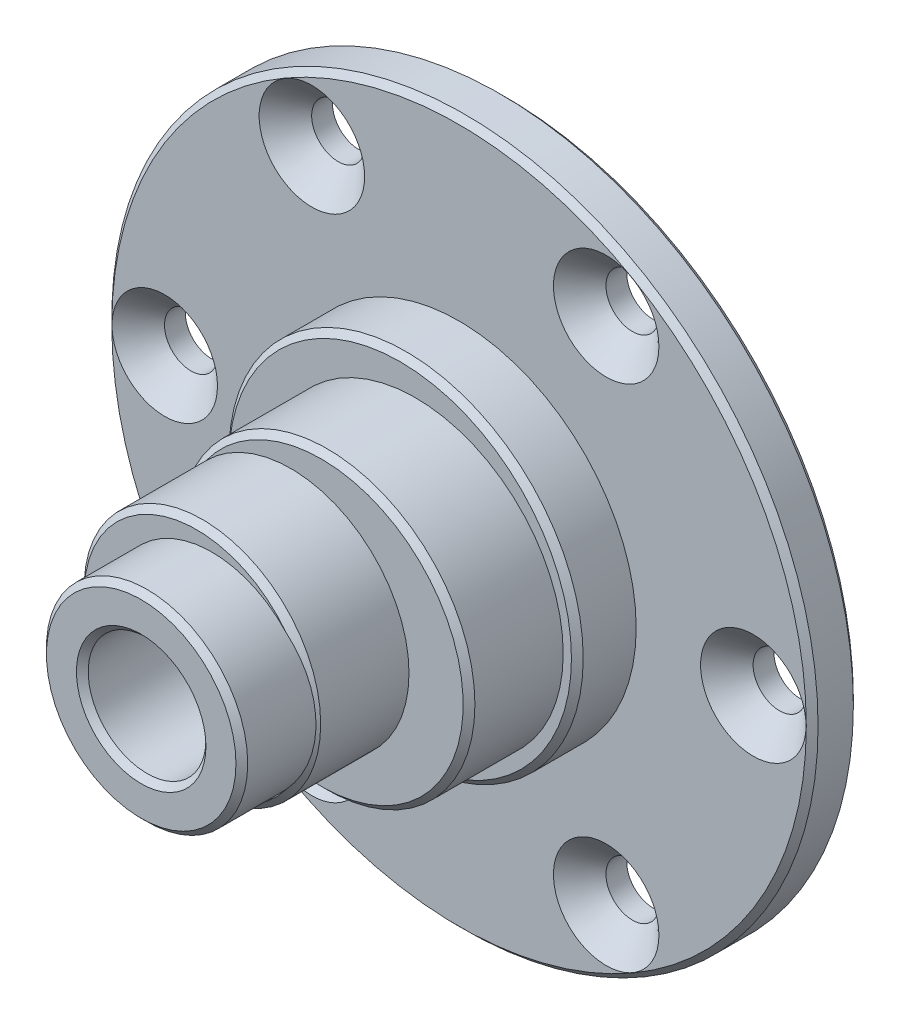
from build123d import *

# Parameters (mm, degrees)
SKETCH1_R                                    = 30
BOSS_EXTRUDE1_DEPTH                          = 4
CSK_FOR_M4_HEX_SOCKET_COUNTERSUNK_CA_2_COUNT = 2
CSK_FOR_M4_HEX_SOCKET_COUNTERSUNK_CA_2_PITCH = 25
CSK_FOR_M4_HEX_SOCKET_COUNTERSUNK_CA_3_COUNT = 2
CSK_FOR_M4_HEX_SOCKET_COUNTERSUNK_CA_3_PITCH = 43.301270189
CSK_FOR_M4_HEX_SOCKET_COUNTERSUNK_CA_4_COUNT = 2
CSK_FOR_M4_HEX_SOCKET_COUNTERSUNK_CA_4_PITCH = 43.301270189
CSK_FOR_M4_HEX_SOCKET_COUNTERSUNK_CA_5_COUNT = 2
CSK_FOR_M4_HEX_SOCKET_COUNTERSUNK_CA_5_PITCH = 50
CSK_FOR_M4_HEX_SOCKET_COUNTERSUNK_CA_6_COUNT = 2
CSK_FOR_M4_HEX_SOCKET_COUNTERSUNK_CA_6_PITCH = 25
SKETCH2_R                                    = 15.05
SKETCH2_R_2                                  = 10.05
BOSS_EXTRUDE3_DEPTH                          = 5
SKETCH5_R                                    = 12
CUT_EXTRUDE2_DEPTH                           = 4
SKETCH6_R                                    = 12.55
BOSS_EXTRUDE4_DEPTH                          = 8
SKETCH7_R                                    = 10.05
BOSS_EXTRUDE5_DEPTH                          = 8
SKETCH8_R                                    = 8.55
BOSS_EXTRUDE6_DEPTH                          = 6
SKETCH9_R                                    = 5
CUT_EXTRUDE3_DEPTH                           = 30
CHAMFER1_SIZE                                = 0.5


with BuildPart() as part:
    # Sketch1 → Boss-Extrude1 (new body)
    with BuildSketch(Plane.XY):
        Circle(SKETCH1_R)
    extrude(amount=BOSS_EXTRUDE1_DEPTH)

    # Sketch3 → CSK for M4 Hex Socket Countersunk Cap Screw1 (revolve, cut)
    with BuildSketch(Plane(origin=(-12.5, 21.650635095, 4), x_dir=(0, -1, 0), z_dir=(1, 0, 0))):
        Polygon((0, 0), (0, 4), (2.25, 4), (2.25, 2.23), (4.48, 0), align=None)
    csk_for_m4_hex_socket_countersunk_cap_sc = revolve(axis=Axis((-12.5, 21.650635095, 10.35), (0, 0, -1)), mode=Mode.SUBTRACT)

    # CSK for M4 Hex Socket Countersunk Ca 2: CSK for M4 Hex Socket Countersunk Cap Screw1 ×2
    with Locations(*[(i * CSK_FOR_M4_HEX_SOCKET_COUNTERSUNK_CA_2_PITCH, 0, 0) for i in range(1, CSK_FOR_M4_HEX_SOCKET_COUNTERSUNK_CA_2_COUNT)]):
        add(csk_for_m4_hex_socket_countersunk_cap_sc, mode=Mode.SUBTRACT)

    # CSK for M4 Hex Socket Countersunk Ca 3: CSK for M4 Hex Socket Countersunk Cap Screw1 ×2
    with Locations(*[Vector(0.8660254037844606, -0.4999999999999621, 0) * (i * CSK_FOR_M4_HEX_SOCKET_COUNTERSUNK_CA_3_PITCH) for i in range(1, CSK_FOR_M4_HEX_SOCKET_COUNTERSUNK_CA_3_COUNT)]):
        add(csk_for_m4_hex_socket_countersunk_cap_sc, mode=Mode.SUBTRACT)

    # CSK for M4 Hex Socket Countersunk Ca 4: CSK for M4 Hex Socket Countersunk Cap Screw1 ×2
    with Locations(*[(0, -i * CSK_FOR_M4_HEX_SOCKET_COUNTERSUNK_CA_4_PITCH, 0) for i in range(1, CSK_FOR_M4_HEX_SOCKET_COUNTERSUNK_CA_4_COUNT)]):
        add(csk_for_m4_hex_socket_countersunk_cap_sc, mode=Mode.SUBTRACT)

    # CSK for M4 Hex Socket Countersunk Ca 5: CSK for M4 Hex Socket Countersunk Cap Screw1 ×2
    with Locations(*[Vector(0.5000000000000379, -0.8660254037844168, 0) * (i * CSK_FOR_M4_HEX_SOCKET_COUNTERSUNK_CA_5_PITCH) for i in range(1, CSK_FOR_M4_HEX_SOCKET_COUNTERSUNK_CA_5_COUNT)]):
        add(csk_for_m4_hex_socket_countersunk_cap_sc, mode=Mode.SUBTRACT)

    # CSK for M4 Hex Socket Countersunk Ca 6: CSK for M4 Hex Socket Countersunk Cap Screw1 ×2
    with Locations(*[Vector(-0.49999999999996236, -0.8660254037844605, 0) * (i * CSK_FOR_M4_HEX_SOCKET_COUNTERSUNK_CA_6_PITCH) for i in range(1, CSK_FOR_M4_HEX_SOCKET_COUNTERSUNK_CA_6_COUNT)]):
        add(csk_for_m4_hex_socket_countersunk_cap_sc, mode=Mode.SUBTRACT)

    # Sketch2 → Boss-Extrude3 (add)
    with BuildSketch(Plane.XY.offset(4)):
        Circle(SKETCH2_R)
        Circle(SKETCH2_R_2, mode=Mode.SUBTRACT)
    extrude(amount=BOSS_EXTRUDE3_DEPTH)

    # Sketch5 → Cut-Extrude2 (cut)
    with BuildSketch(Plane(origin=(0, 0, 0), x_dir=(-1, 0, 0), z_dir=(0, 0, -1))):
        Circle(SKETCH5_R)
    extrude(amount=-CUT_EXTRUDE2_DEPTH, mode=Mode.SUBTRACT)

    # Sketch6 → Boss-Extrude4 (add)
    with BuildSketch(Plane.XY.offset(9)):
        with Locations((1.3, 0)):
            Circle(SKETCH6_R)
    extrude(amount=BOSS_EXTRUDE4_DEPTH)

    # Sketch7 → Boss-Extrude5 (add)
    with BuildSketch(Plane.XY.offset(17)):
        with Locations(Location((-1.3, 0, 0), (0, 0, 162.13454876))):
            Circle(SKETCH7_R)
    extrude(amount=BOSS_EXTRUDE5_DEPTH)

    # Sketch8 → Boss-Extrude6 (add)
    with BuildSketch(Plane.XY.offset(25)):
        Circle(SKETCH8_R)
    extrude(amount=BOSS_EXTRUDE6_DEPTH)

    # Sketch9 → Cut-Extrude3 (cut)
    with BuildSketch(Plane.XY.offset(31)):
        Circle(SKETCH9_R)
    extrude(amount=-CUT_EXTRUDE3_DEPTH, mode=Mode.SUBTRACT)

    # Chamfer1
    # the kernel refuses this chamfer: 0.5 mm, written as the material it takes off along each edge
    with BuildSketch(Plane(origin=(0, 0, 0), x_dir=(1, 0, 0), z_dir=(0, -1, 0))) as chamfer1_piece_1:
        Polygon((30, CHAMFER1_SIZE), (30 - CHAMFER1_SIZE, 0), (30, 0), align=None)
    revolve(axis=Axis((0, 0, 0), (0, 0, 1)), mode=Mode.SUBTRACT)
    with BuildSketch(Plane(origin=(0, 0, 9), x_dir=(1, 0, 0), z_dir=(0, -1, 0))) as chamfer1_piece_2:
        Polygon((15.05, -CHAMFER1_SIZE), (15.05 - CHAMFER1_SIZE, 0), (15.05, 0), align=None)
    revolve(axis=Axis((0, 0, 9), (0, 0, 1)), mode=Mode.SUBTRACT)
    with BuildSketch(Plane(origin=(0, 0, 4), x_dir=(1, 0, 0), z_dir=(0, -1, 0))) as chamfer1_piece_3:
        Polygon((30, -CHAMFER1_SIZE), (30 - CHAMFER1_SIZE, 0), (30, 0), align=None)
    revolve(axis=Axis((0, 0, 4), (0, 0, 1)), mode=Mode.SUBTRACT)
    with BuildSketch(Plane(origin=(0, 0, 4), x_dir=(1, 0, 0), z_dir=(0, -1, 0))) as chamfer1_piece_4:
        Polygon((10.05 + CHAMFER1_SIZE, 0), (10.05, CHAMFER1_SIZE), (10.05, 0), align=None)
    revolve(axis=Axis((0, 0, 4), (0, 0, 1)), mode=Mode.SUBTRACT)
    with BuildSketch(Plane(origin=(0, 0, 0), x_dir=(-1, 0, 0), z_dir=(0, -1, 0))) as chamfer1_piece_5:
        Polygon((12 + CHAMFER1_SIZE, 0), (12, -CHAMFER1_SIZE), (12, 0), align=None)
    revolve(axis=Axis((0, 0, 0), (0, 0, -1)), mode=Mode.SUBTRACT)
    with BuildSketch(Plane(origin=(1.3, 0, 17), x_dir=(-0.9894169628260336, -0.1451002194075096, 0), z_dir=(-0.1451002194075096, 0.9894169628260336, 0))) as chamfer1_piece_6_section:
        Polygon((12.55, -CHAMFER1_SIZE), (12.55 - CHAMFER1_SIZE, 0), (12.55, 0), align=None)
    chamfer1_piece_6 = revolve(axis=Axis((1.3, 0, 17), (0, 0, 1)), revolution_arc=171.656917286, mode=Mode.PRIVATE)
    chamfer1_piece_6 = chamfer1_piece_6 - Plane(origin=(-1.3, 0, 16.761451234), x_dir=(-0.9517795637185023, 0.3067827604149514, 0), z_dir=(0, 0, -1)) * Cylinder(10.05, 51, mode=Mode.PRIVATE)
    add(chamfer1_piece_6, mode=Mode.SUBTRACT)
    with BuildSketch(Plane(origin=(-1.3, 0, 25), x_dir=(-0.9517795637185023, 0.3067827604149514, 0), z_dir=(0.3067827604149514, 0.9517795637185023, 0))) as chamfer1_piece_7_section:
        Polygon((10.05, -CHAMFER1_SIZE), (10.05 - CHAMFER1_SIZE, 0), (10.05, 0), align=None)
    chamfer1_piece_7 = revolve(axis=Axis((-1.3, 0, 25), (0, 0, 1)), mode=Mode.PRIVATE)
    chamfer1_piece_7 = chamfer1_piece_7 - Plane(origin=(0, 0, 24.76381896), x_dir=(1, 0, 0), z_dir=(0, 0, -1)) * Cylinder(8.55, 41, mode=Mode.PRIVATE)
    add(chamfer1_piece_7, mode=Mode.SUBTRACT)
    with BuildSketch(Plane(origin=(0, 0, 31), x_dir=(1, 0, 0), z_dir=(0, -1, 0))) as chamfer1_piece_8:
        Polygon((8.55 - CHAMFER1_SIZE, 0), (8.55, -CHAMFER1_SIZE), (8.55, 0), align=None)
    revolve(axis=Axis((0, 0, 31), (0, 0, 1)), mode=Mode.SUBTRACT)
    with BuildSketch(Plane(origin=(0, 0, 31), x_dir=(1, 0, 0), z_dir=(0, -1, 0))) as chamfer1_piece_9:
        Polygon((5, -CHAMFER1_SIZE), (5 + CHAMFER1_SIZE, 0), (5, 0), align=None)
    revolve(axis=Axis((0, 0, 31), (0, 0, 1)), mode=Mode.SUBTRACT)
    with BuildSketch(Plane(origin=(1.3, 0, 17), x_dir=(1, 0, 0), z_dir=(0, -1, 0))) as chamfer1_piece_10_section:
        Polygon((12.55, -CHAMFER1_SIZE), (12.55 - CHAMFER1_SIZE, 0), (12.55, 0), align=None)
    chamfer1_piece_10 = revolve(axis=Axis((1.3, 0, 17), (0, 0, 1)), revolution_arc=171.656917286, mode=Mode.PRIVATE)
    chamfer1_piece_10 = chamfer1_piece_10 - Plane(origin=(-1.3, 0, 16.761451234), x_dir=(-0.9517795637185023, 0.3067827604149514, 0), z_dir=(0, 0, -1)) * Cylinder(10.05, 51, mode=Mode.PRIVATE)
    add(chamfer1_piece_10, mode=Mode.SUBTRACT)


solid = part.part
